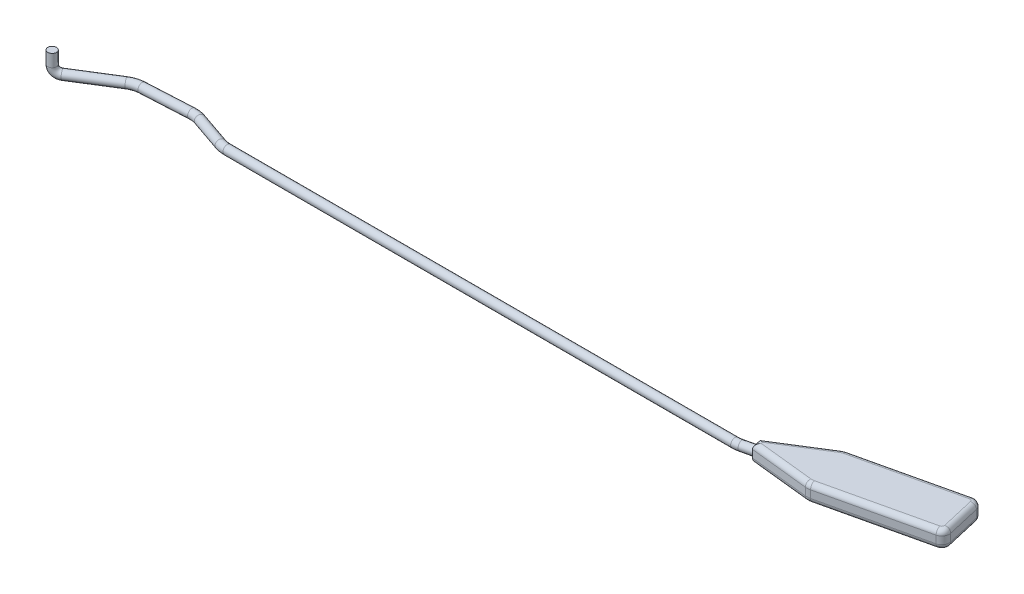
from build123d import *

# Parameters (mm, degrees)
SKETCH11_R          = 1.75
SKETCH8_R           = 1.75
BOSS_EXTRUDE1_DEPTH = 3.5
FILLET1_R           = 2
FILLET2_R           = 2


with BuildPart() as part:
    # Sweep1: sweep along a path in Sketch1
    with BuildLine(Plane(origin=(0, 0, 0), x_dir=(1, 0, 0), z_dir=(0, 1, 0))) as sweep1_path:
        Line((0, 0), (-4.736065928, -1.093406974))
        ThreePointArc((-4.736065928, -1.093406974), (-5.853544334, -1.285424883), (-6.985576472, -1.349706326))
        Line((-6.985576472, -1.349706326), (-210.672794298, -1.349706326))
        ThreePointArc((-210.672794298, -1.349706326), (-212.323270357, -1.212562341), (-213.928475842, -0.804892082))
        Line((-213.928475842, -0.804892082), (-226.582134244, 3.552111915))
        ThreePointArc((-226.582134244, 3.552111915), (-228.446084779, 3.999606846), (-230.361175351, 4.083221506))
        Line((-230.361175351, 4.083221506), (-249.305198661, 3.090407314))
        ThreePointArc((-249.305198661, 3.090407314), (-251.788897094, 2.641281474), (-254.081031741, 1.584592928))
        Line((-254.081031741, 1.584592928), (-268.848792164, -7.643327957))
    # Sketch11 → Sweep1 (sweep)
    with BuildSketch(Plane(origin=(0, 0, 0), x_dir=(0.22495105434386561, 0, 0.9743700647852351), z_dir=(-0.9743700647852351, 0, 0.22495105434386561))):
        Circle(SKETCH11_R)
    sweep(path=sweep1_path.line)

    # Sweep3: sweep along a curve in space
    with BuildLine() as sweep3_path:
        Line((-272.410594168, 3, 9.868988866), (-272.410594168, 8, 9.868988866))
        ThreePointArc((-269.866449879, 0, 8.279231074), (-271.665431558, 0.878679656, 9.403359589), (-272.410594168, 3, 9.868988866))
        Line((-269.866449879, 0, 8.279231074), (-268.848792164, 0, 7.643327957))
    # Sketch8 → Sweep3 (sweep)
    with BuildSketch(Plane(origin=(-196.787061579, 0, 122.966203633), x_dir=(0.5299192642332071, 0, 0.8480480961564246), z_dir=(-0.8480480961564246, 0, 0.5299192642332071))):
        with Locations((-135.986244411, 0)):
            Circle(SKETCH8_R)
    sweep(path=sweep3_path.line)

    # Sketch5 → Boss-Extrude1 (add, symmetric)
    with BuildSketch(Plane(origin=(0, 0, 0), x_dir=(1, 0, 0), z_dir=(0, 1, 0))):
        with BuildLine():
            Line((-0.393664345, 1.705147613), (19.813870271, 14.370895509))
            ThreePointArc((19.813870271, 14.370895509), (20.700469104, 14.828681695), (21.650674926, 15.133205221))
            Line((21.650674926, 15.133205221), (62.574217647, 24.581149504))
            ThreePointArc((62.574217647, 24.581149504), (64.838828602, 24.202183598), (66.172181004, 22.332892472))
            Line((66.172181004, 22.332892472), (69.265258001, 8.935304082))
            ThreePointArc((69.265258001, 8.935304082), (68.886292095, 6.670693126), (67.01700097, 5.337340724))
            Line((67.01700097, 5.337340724), (26.093458249, -4.110603558))
            ThreePointArc((26.093458249, -4.110603558), (25.105924586, -4.253442442), (24.108374578, -4.230646291))
            Line((24.108374578, -4.230646291), (0.393664345, -1.705147613))
            Line((0.393664345, -1.705147613), (-0.393664345, 1.705147613))
        make_face()
    extrude(amount=BOSS_EXTRUDE1_DEPTH, both=True)

    # Fillet1
    # the kernel refuses this fillet: 2 mm, written as the material it takes off along each edge
    with BuildSketch(Plane(origin=(23.000381252, 3.5, -9.286984832), x_dir=(-0.5310851635150771, 0, -0.847318446095778), z_dir=(-0.847318446095778, 0, 0.5310851635150771))) as fillet1_piece_1:
        with BuildLine():
            CenterArc((6 - FILLET1_R, FILLET1_R), FILLET1_R, 270, 90)
            Line((6, FILLET1_R), (6, 0))
            Line((6, 0), (6 - FILLET1_R, 0))
        make_face()
    revolve(axis=Axis((23.000381252, 3.5, -9.286984832), (0, -1, 0)), revolution_arc=19.078804313, mode=Mode.SUBTRACT)
    with BuildSketch(Plane(origin=(-4.630256576, 3.5, 0.950278204), x_dir=(0, -1, 0), z_dir=(0.8473184460957748, 0, -0.5310851635150822))) as fillet1_piece_2_section:
        with BuildLine():
            CenterArc((FILLET1_R, -FILLET1_R), FILLET1_R, 90, 90)
            Line((0, -FILLET1_R), (0, 0))
            Line((0, 0), (FILLET1_R, 0))
        make_face()
    fillet1_piece_2 = extrude(amount=28.848807622, mode=Mode.PRIVATE)
    fillet1_piece_2 = split(fillet1_piece_2, bisect_by=Plane(origin=(-1.099290547, 3.044511154, -4.761550481), z_dir=(0.9743700647852351, 0, -0.22495105434386561)), keep=Keep.TOP, mode=Mode.PRIVATE)
    add(fillet1_piece_2, mode=Mode.SUBTRACT)
    with BuildSketch(Plane(origin=(1.518419617, 3.5, 6.576997937), x_dir=(0, -1, 0), z_dir=(-0.22495105434386561, 0, -0.9743700647852351))) as fillet1_piece_3_section:
        with BuildLine():
            CenterArc((FILLET1_R, -FILLET1_R), FILLET1_R, 90, 90)
            Line((0, -FILLET1_R), (0, 0))
            Line((0, 0), (FILLET1_R, 0))
        make_face()
    fillet1_piece_3 = extrude(amount=13.5, mode=Mode.PRIVATE)
    fillet1_piece_3 = fillet1_piece_3 - Plane(origin=(0.460325238, 0, -0.106274455), x_dir=(0.22495105434386553, 0, 0.9743700647852351), z_dir=(-0.9743700647852351, 0, 0.22495105434386553)) * Cylinder(1.75, 36, mode=Mode.PRIVATE)
    add(fillet1_piece_3, mode=Mode.SUBTRACT)
    with BuildSketch(Plane(origin=(24.108374578, 3.5, 4.230646291), x_dir=(0, -1, 0), z_dir=(-0.9943771868431155, 0, -0.10589622413463053))) as fillet1_piece_4_section:
        with BuildLine():
            CenterArc((FILLET1_R, -FILLET1_R), FILLET1_R, 90, 90)
            Line((0, -FILLET1_R), (0, 0))
            Line((0, 0), (FILLET1_R, 0))
        make_face()
    fillet1_piece_4 = extrude(amount=28.848807622, mode=Mode.PRIVATE)
    fillet1_piece_4 = split(fillet1_piece_4, bisect_by=Plane(origin=(1.099289941, 3.044511564, 4.761547859), z_dir=(0.9743700647852351, 0, -0.22495105434386561)), keep=Keep.TOP, mode=Mode.PRIVATE)
    add(fillet1_piece_4, mode=Mode.SUBTRACT)
    with BuildSketch(Plane(origin=(24.743751923, 3.5, -1.73561683), x_dir=(0.22495105434386634, 0, 0.9743700647852349), z_dir=(0.9743700647852349, 0, -0.22495105434386634))) as fillet1_piece_5:
        with BuildLine():
            CenterArc((6 - FILLET1_R, FILLET1_R), FILLET1_R, 270, 90)
            Line((6, FILLET1_R), (6, 0))
            Line((6, 0), (6 - FILLET1_R, 0))
        make_face()
    revolve(axis=Axis((24.743751923, 3.5, -1.73561683), (0, -1, 0)), revolution_arc=19.078804313, mode=Mode.SUBTRACT)
    with BuildSketch(Plane(origin=(67.01700097, 3.5, -5.337340724), x_dir=(-0.22495105434386584, 0, -0.9743700647852351), z_dir=(-0.9743700647852351, 0, 0.22495105434386584)), Plane(origin=(21.650674926, 3.5, -15.133205221), x_dir=(0.22495105434386575, 0, 0.974370064785235), z_dir=(0.9743700647852351, 0, -0.22495105434386578))) as fillet1_piece_6:
        with BuildLine():
            CenterArc((FILLET1_R, FILLET1_R), FILLET1_R, 180, 90)
            Line((0, FILLET1_R), (0, 0))
            Line((0, 0), (FILLET1_R, 0))
        make_face()
    extrude(amount=42, mode=Mode.SUBTRACT)
    with BuildSketch(Plane(origin=(66.342147807, 3.5, -8.260450918), x_dir=(0.9743700647852336, 0, -0.22495105434387175), z_dir=(-0.22495105434387175, 0, -0.9743700647852336))) as fillet1_piece_7:
        with BuildLine():
            CenterArc((3 - FILLET1_R, FILLET1_R), FILLET1_R, 270, 90)
            Line((3, FILLET1_R), (3, 0))
            Line((3, 0), (3 - FILLET1_R, 0))
        make_face()
    revolve(axis=Axis((66.342147807, 3.5, -8.260450918), (0, -1, 0)), revolution_arc=90, mode=Mode.SUBTRACT)
    with BuildSketch(Plane(origin=(66.172181004, 3.5, -22.332892472), x_dir=(-0.9743700647852354, 0, 0.22495105434386456), z_dir=(0.22495105434386456, 0, 0.9743700647852354))) as fillet1_piece_8:
        with BuildLine():
            CenterArc((FILLET1_R, FILLET1_R), FILLET1_R, 180, 90)
            Line((0, FILLET1_R), (0, 0))
            Line((0, 0), (FILLET1_R, 0))
        make_face()
    extrude(amount=13.75, mode=Mode.SUBTRACT)
    with BuildSketch(Plane(origin=(63.24907081, 3.5, -21.658039309), x_dir=(-0.22495105434387033, 0, -0.974370064785234), z_dir=(-0.974370064785234, 0, 0.22495105434387033))) as fillet1_piece_9:
        with BuildLine():
            CenterArc((3 - FILLET1_R, FILLET1_R), FILLET1_R, 270, 90)
            Line((3, FILLET1_R), (3, 0))
            Line((3, 0), (3 - FILLET1_R, 0))
        make_face()
    revolve(axis=Axis((63.24907081, 3.5, -21.658039309), (0, -1, 0)), revolution_arc=90, mode=Mode.SUBTRACT)

    # Fillet2
    # the kernel refuses this fillet: 2 mm, written as the material it takes off along each edge
    with BuildSketch(Plane(origin=(23.000381252, -3.5, -9.286984832), x_dir=(-0.5310851635150771, 0, -0.847318446095778), z_dir=(-0.847318446095778, 0, 0.5310851635150771))) as fillet2_piece_1:
        with BuildLine():
            CenterArc((6 - FILLET2_R, -FILLET2_R), FILLET2_R, 0, 90)
            Line((6, -FILLET2_R), (6, 0))
            Line((6, 0), (6 - FILLET2_R, 0))
        make_face()
    revolve(axis=Axis((23.000381252, -3.5, -9.286984832), (0, -1, 0)), revolution_arc=19.078804313, mode=Mode.SUBTRACT)
    with BuildSketch(Plane(origin=(-4.630256576, -3.5, 0.950278204), x_dir=(0, 1, 0), z_dir=(0.8473184460957748, 0, -0.5310851635150822))) as fillet2_piece_2_section:
        with BuildLine():
            CenterArc((FILLET2_R, FILLET2_R), FILLET2_R, 180, 90)
            Line((0, FILLET2_R), (0, 0))
            Line((0, 0), (FILLET2_R, 0))
        make_face()
    fillet2_piece_2 = extrude(amount=28.848807622, mode=Mode.PRIVATE)
    fillet2_piece_2 = split(fillet2_piece_2, bisect_by=Plane(origin=(-1.099290547, -3.044511154, -4.761550481), z_dir=(0.9743700647852351, 0, -0.22495105434386561)), keep=Keep.TOP, mode=Mode.PRIVATE)
    add(fillet2_piece_2, mode=Mode.SUBTRACT)
    with BuildSketch(Plane(origin=(1.518419617, -3.5, 6.576997937), x_dir=(0, 1, 0), z_dir=(-0.22495105434386561, 0, -0.9743700647852351))) as fillet2_piece_3_section:
        with BuildLine():
            CenterArc((FILLET2_R, FILLET2_R), FILLET2_R, 180, 90)
            Line((0, FILLET2_R), (0, 0))
            Line((0, 0), (FILLET2_R, 0))
        make_face()
    fillet2_piece_3 = extrude(amount=13.5, mode=Mode.PRIVATE)
    fillet2_piece_3 = fillet2_piece_3 - Plane(origin=(0.460325238, 0, -0.106274455), x_dir=(0.22495105434386553, 0, 0.9743700647852351), z_dir=(-0.9743700647852351, 0, 0.22495105434386553)) * Cylinder(1.75, 36, mode=Mode.PRIVATE)
    add(fillet2_piece_3, mode=Mode.SUBTRACT)
    with BuildSketch(Plane(origin=(24.108374578, -3.5, 4.230646291), x_dir=(0, 1, 0), z_dir=(-0.9943771868431155, 0, -0.10589622413463053))) as fillet2_piece_4_section:
        with BuildLine():
            CenterArc((FILLET2_R, FILLET2_R), FILLET2_R, 180, 90)
            Line((0, FILLET2_R), (0, 0))
            Line((0, 0), (FILLET2_R, 0))
        make_face()
    fillet2_piece_4 = extrude(amount=28.848807622, mode=Mode.PRIVATE)
    fillet2_piece_4 = split(fillet2_piece_4, bisect_by=Plane(origin=(1.099289941, -3.044511564, 4.761547859), z_dir=(0.9743700647852351, 0, -0.22495105434386561)), keep=Keep.TOP, mode=Mode.PRIVATE)
    add(fillet2_piece_4, mode=Mode.SUBTRACT)
    with BuildSketch(Plane(origin=(24.743751923, -3.5, -1.73561683), x_dir=(0.22495105434386634, 0, 0.9743700647852349), z_dir=(0.9743700647852349, 0, -0.22495105434386634))) as fillet2_piece_5:
        with BuildLine():
            CenterArc((6 - FILLET2_R, -FILLET2_R), FILLET2_R, 0, 90)
            Line((6, -FILLET2_R), (6, 0))
            Line((6, 0), (6 - FILLET2_R, 0))
        make_face()
    revolve(axis=Axis((24.743751923, -3.5, -1.73561683), (0, -1, 0)), revolution_arc=19.078804313, mode=Mode.SUBTRACT)
    with BuildSketch(Plane(origin=(67.01700097, -3.5, -5.337340724), x_dir=(-0.22495105434386584, 0, -0.9743700647852351), z_dir=(-0.9743700647852351, 0, 0.22495105434386584)), Plane(origin=(21.650674926, -3.5, -15.133205221), x_dir=(0.22495105434386575, 0, 0.974370064785235), z_dir=(0.9743700647852351, 0, -0.22495105434386578))) as fillet2_piece_6:
        with BuildLine():
            CenterArc((FILLET2_R, -FILLET2_R), FILLET2_R, 90, 90)
            Line((0, -FILLET2_R), (0, 0))
            Line((0, 0), (FILLET2_R, 0))
        make_face()
    extrude(amount=42, mode=Mode.SUBTRACT)
    with BuildSketch(Plane(origin=(66.342147807, -3.5, -8.260450918), x_dir=(0.9743700647852336, 0, -0.22495105434387175), z_dir=(-0.22495105434387175, 0, -0.9743700647852336))) as fillet2_piece_7:
        with BuildLine():
            CenterArc((3 - FILLET2_R, -FILLET2_R), FILLET2_R, 0, 90)
            Line((3, -FILLET2_R), (3, 0))
            Line((3, 0), (3 - FILLET2_R, 0))
        make_face()
    revolve(axis=Axis((66.342147807, -3.5, -8.260450918), (0, -1, 0)), revolution_arc=90, mode=Mode.SUBTRACT)
    with BuildSketch(Plane(origin=(66.172181004, -3.5, -22.332892472), x_dir=(-0.9743700647852354, 0, 0.22495105434386456), z_dir=(0.22495105434386456, 0, 0.9743700647852354))) as fillet2_piece_8:
        with BuildLine():
            CenterArc((FILLET2_R, -FILLET2_R), FILLET2_R, 90, 90)
            Line((0, -FILLET2_R), (0, 0))
            Line((0, 0), (FILLET2_R, 0))
        make_face()
    extrude(amount=13.75, mode=Mode.SUBTRACT)
    with BuildSketch(Plane(origin=(63.24907081, -3.5, -21.658039309), x_dir=(-0.22495105434387033, 0, -0.974370064785234), z_dir=(-0.974370064785234, 0, 0.22495105434387033))) as fillet2_piece_9:
        with BuildLine():
            CenterArc((3 - FILLET2_R, -FILLET2_R), FILLET2_R, 0, 90)
            Line((3, -FILLET2_R), (3, 0))
            Line((3, 0), (3 - FILLET2_R, 0))
        make_face()
    revolve(axis=Axis((63.24907081, -3.5, -21.658039309), (0, -1, 0)), revolution_arc=90, mode=Mode.SUBTRACT)


solid = part.part
